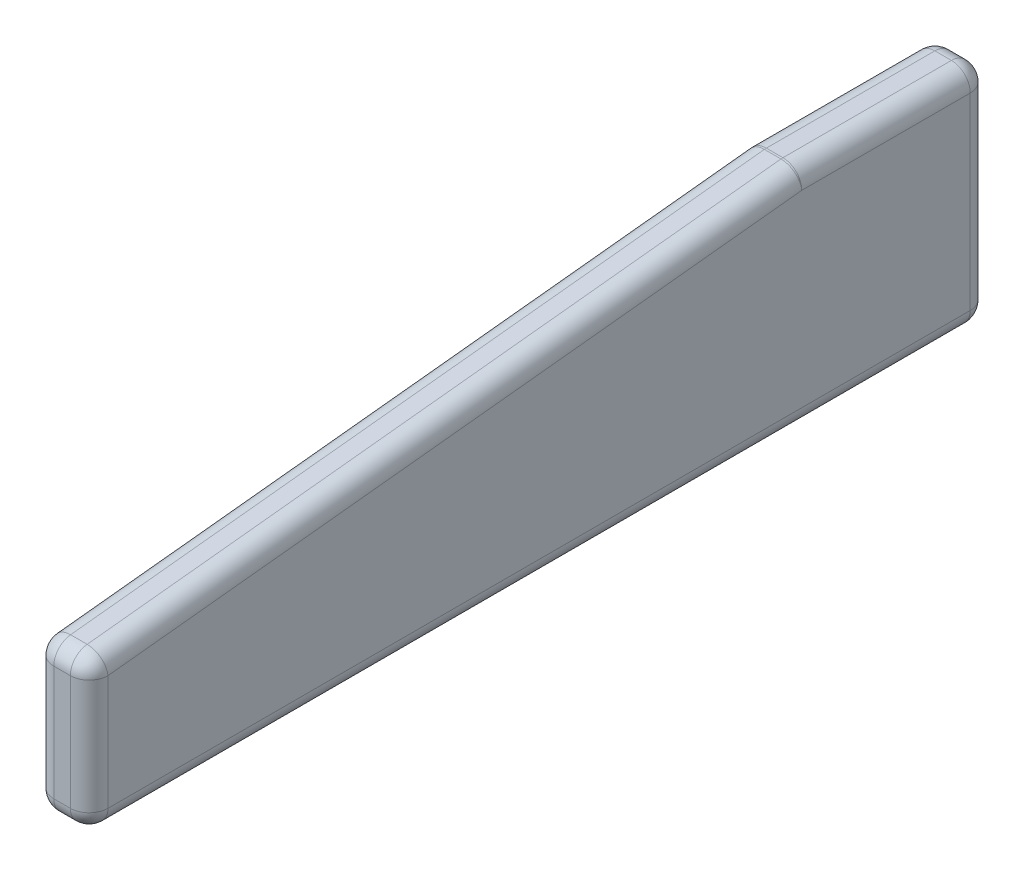
from build123d import *

# Parameters (mm, degrees)
BOSS_EXTRUDE1_DEPTH = 18.288
FILLET1_R           = 6.35


with BuildPart() as part:
    # Sketch1 → Boss-Extrude1 (new body)
    with BuildSketch(Plane(origin=(0, 0, 0), x_dir=(0, 0, -1), z_dir=(1, 0, 0))):
        with BuildLine():
            Line((-166.973473818, -57.646230654), (123.785960254, -57.646230654))
            ThreePointArc((123.785960254, -57.646230654), (128.276088314, -55.786358715), (130.135960254, -51.296230654))
            Line((130.135960254, -51.296230654), (130.135960254, 12.203769346))
            ThreePointArc((130.135960254, 12.203769346), (128.276088314, 16.693897406), (123.785960254, 18.553769346))
            Line((123.785960254, 18.553769346), (66.971101736, 18.553769346))
            ThreePointArc((66.971101736, 18.553769346), (66.636426055, 18.5449437), (66.302680683, 18.518491295))
            Line((66.302680683, 18.518491295), (-167.641894871, -6.244828564))
            ThreePointArc((-167.641894871, -6.244828564), (-171.694012648, -8.31231457), (-173.323473818, -12.559550513))
            Line((-173.323473818, -12.559550513), (-173.323473818, -51.296230654))
            ThreePointArc((-173.323473818, -51.296230654), (-171.463601879, -55.786358715), (-166.973473818, -57.646230654))
        make_face()
    extrude(amount=BOSS_EXTRUDE1_DEPTH)

    # Fillet1
    fillet1_edges = [part.edges().sort_by_distance(p)[0] for p in [
        (0, 16.693897406, -128.276088314),
        (0, -19.546230654, -130.135960254),
        (0, -55.786358715, -128.276088314),
        (0, -57.646230654, 21.593756782),
        (0, -55.786358715, 171.463601879),
        (0, -31.927890584, 173.323473818),
        (0, -8.31231457, 171.694012648),
        (0, 6.136831366, 50.669607094),
        (0, 18.5449437, -66.636426055),
        (18.288, 18.5449437, -66.636426055),
        (18.288, 18.553769346, -95.378530995),
        (18.288, 16.693897406, -128.276088314),
        (18.288, -19.546230654, -130.135960254),
        (18.288, -55.786358715, -128.276088314),
        (18.288, -57.646230654, 21.593756782),
        (18.288, -55.786358715, 171.463601879),
        (18.288, -31.927890584, 173.323473818),
        (18.288, -8.31231457, 171.694012648),
        (0, 18.553769346, -95.378530995),
        (18.288, 6.136831366, 50.669607094),
    ]]
    fillet(fillet1_edges, radius=FILLET1_R)


solid = part.part
